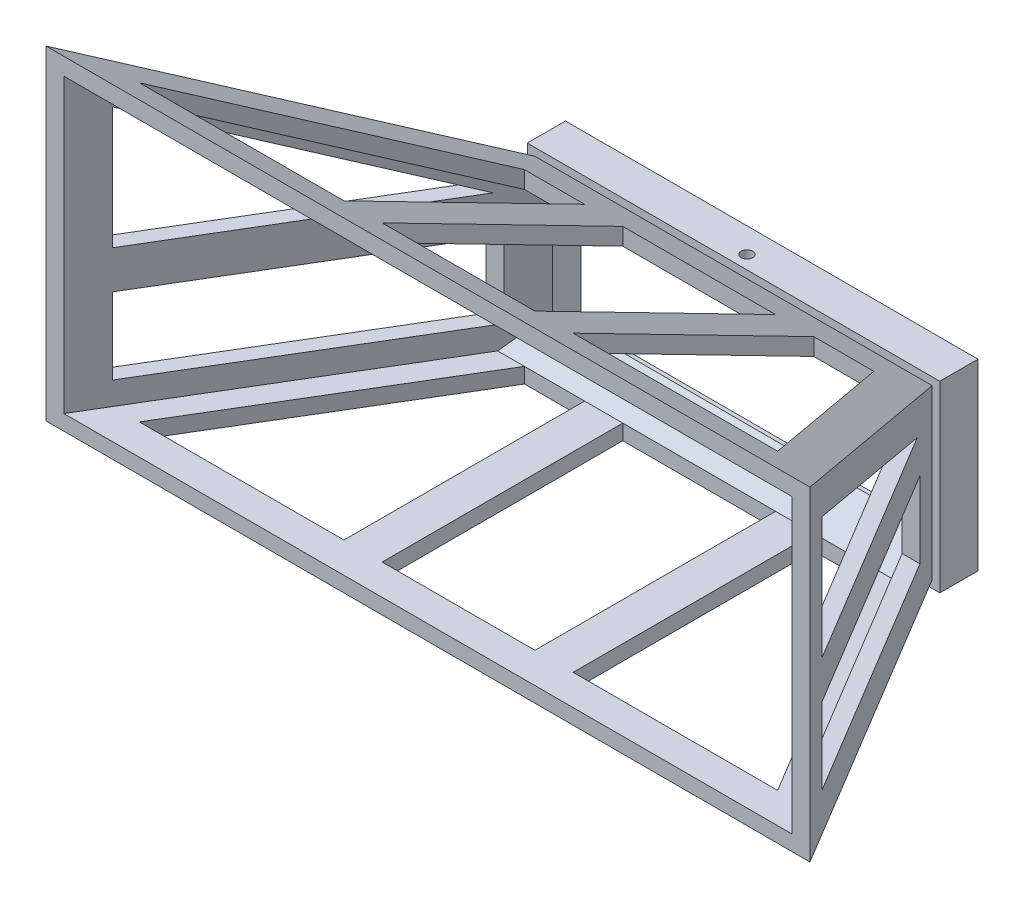
from build123d import *

# Parameters (mm, degrees)
SKETCH_1_W          = 108
SKETCH_1_H          = 48
SKETCH_1_W_2        = 100
SKETCH_1_H_2        = 40
EXTRUDE_1_DEPTH     = 10
SKETCH_6_W          = 40
SKETCH_6_H          = 63
CUT_EXTRUDE_1_DEPTH = 102
SKETCH_7_W          = 64
SKETCH_7_H          = 20
CUT_EXTRUDE_2_DEPTH = 199
SKETCH_8_R          = 1.5
CUT_EXTRUDE_3_DEPTH = 139


with BuildPart() as part:
    # 草图1 → 凸台-拉伸1 (new body)
    with BuildSketch(Plane.XY):
        Rectangle(SKETCH_1_W, SKETCH_1_H)
        Rectangle(SKETCH_1_W_2, SKETCH_1_H_2, mode=Mode.SUBTRACT)
    extrude(amount=EXTRUDE_1_DEPTH)

    # 草图5 → 放样3 section 0
    with BuildSketch(Plane.XY.offset(90)):
        with BuildLine():
            Line((-100, -22), (100, -22))
            Line((100, -22), (100, 63))
            Line((100, 63), (-100, 63))
            Line((-100, 63), (-100, -22))
        make_face()
    # 草图2 → 放样3 section 1
    with BuildSketch(Plane.XY.offset(10)):
        with BuildLine():
            Line((52, 22), (-52, 22))
            Line((-52, 22), (-52, -22))
            Line((-52, -22), (52, -22))
            Line((52, -22), (52, 22))
        make_face()
    loft()

    # 抽壳2: read off the stored shape, not the designer's step
    # 抽壳2: loft between two sections, ruled curve by curve
    shell_2_from = [
        Edge.make_line((95.335238484, -18, 90), (95.335238484, 58.505280876, 90)),
        Edge.make_line((95.335238484, 58.505280876, 90), (-95.335238484, 58.505280876, 90)),
        Edge.make_line((-95.335238484, -18, 90), (95.335238484, -18, 90)),
        Edge.make_line((-95.335238484, 58.505280876, 90), (-95.335238484, -18, 90)),
    ]
    shell_2_to = [
        Edge.make_line((47.335238484, -18, 10), (47.335238484, 17.505280876, 10)),
        Edge.make_line((47.335238484, 17.505280876, 10), (-47.335238484, 17.505280876, 10)),
        Edge.make_line((-47.335238484, -18, 10), (47.335238484, -18, 10)),
        Edge.make_line((-47.335238484, 17.505280876, 10), (-47.335238484, -18, 10)),
    ]
    shell_2 = Solid(Shell([*[Face.make_surface_from_curves(shell_2_from[k], shell_2_to[k]) for k in range(4)], Face(Wire(shell_2_from)), Face(Wire(shell_2_to))]))
    add(shell_2, mode=Mode.SUBTRACT)

    # 草图6 → 切除-拉伸1 (cut)
    with BuildSketch(Plane.XZ.offset(24)):
        with Locations((0, 50.5)):
            Rectangle(SKETCH_6_W, SKETCH_6_H)
        Polygon((30, 19), (30, 82), (83.53809621, 82), (45.73809621, 19), align=None)
        Polygon((-45.73809621, 19), (-30, 19), (-30, 82), (-83.53809621, 82), align=None)
    extrude(amount=-CUT_EXTRUDE_1_DEPTH, mode=Mode.SUBTRACT)

    # 草图7 → 切除-拉伸2 (cut, symmetric)
    with BuildSketch(Plane.ZY.offset(54)):
        with Locations((50, -2)):
            Rectangle(SKETCH_7_W, SKETCH_7_H)
        Polygon((82, 49.910561753), (19.735489263, 18), (82, 18), align=None)
    extrude(amount=CUT_EXTRUDE_2_DEPTH, both=True, mode=Mode.SUBTRACT)

    # 草图8 → 切除-拉伸3 (cut)
    with BuildSketch(Plane(origin=(0, 24, 0), x_dir=(1, 0, 0), z_dir=(0, 1, 0))):
        with Locations(Location((0, -6.5, 0), (0, 0, 180))):
            Circle(SKETCH_8_R)
    extrude(amount=-CUT_EXTRUDE_3_DEPTH, mode=Mode.SUBTRACT)

    # 草图13 → 放样5 section 0
    with BuildSketch(Plane(origin=(30.393557709, 0, -18.236134625), x_dir=(0.5144957554275269, 0, 0.857492925712544), z_dir=(-0.857492925712544, 0, 0.5144957554275269))):
        with BuildLine():
            Line((32.928708539, -11), (43.42442195, -18))
            Line((43.42442195, -18), (32.928708539, -18))
            Line((32.928708539, -18), (32.928708539, -11))
        make_face()
    # 草图12 → 放样5 section 1
    with BuildSketch(Plane(origin=(-30.393557709, 0, -18.236134625), x_dir=(0.5144957554275263, 0, -0.8574929257125443), z_dir=(0.8574929257125443, 0, 0.5144957554275263))):
        with BuildLine():
            Line((-32.928708539, -11), (-43.42442195, -18))
            Line((-43.42442195, -18), (-32.928708539, -18))
            Line((-32.928708539, -18), (-32.928708539, -11))
        make_face()
    loft()


solid = part.part
